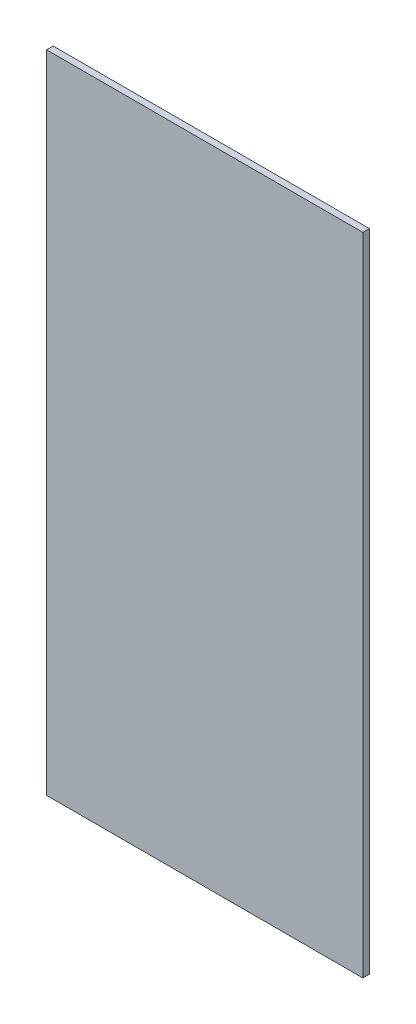
from build123d import *

# Parameters (mm, degrees)
SKETCH1_W           = 877.8875
SKETCH1_H           = 1792.2875
BOSS_EXTRUDE1_DEPTH = 18.25625


with BuildPart() as part:
    # Sketch1 → Boss-Extrude1 (new body)
    with BuildSketch(Plane.XY):
        Rectangle(SKETCH1_W, SKETCH1_H)
    extrude(amount=BOSS_EXTRUDE1_DEPTH)


solid = part.part
